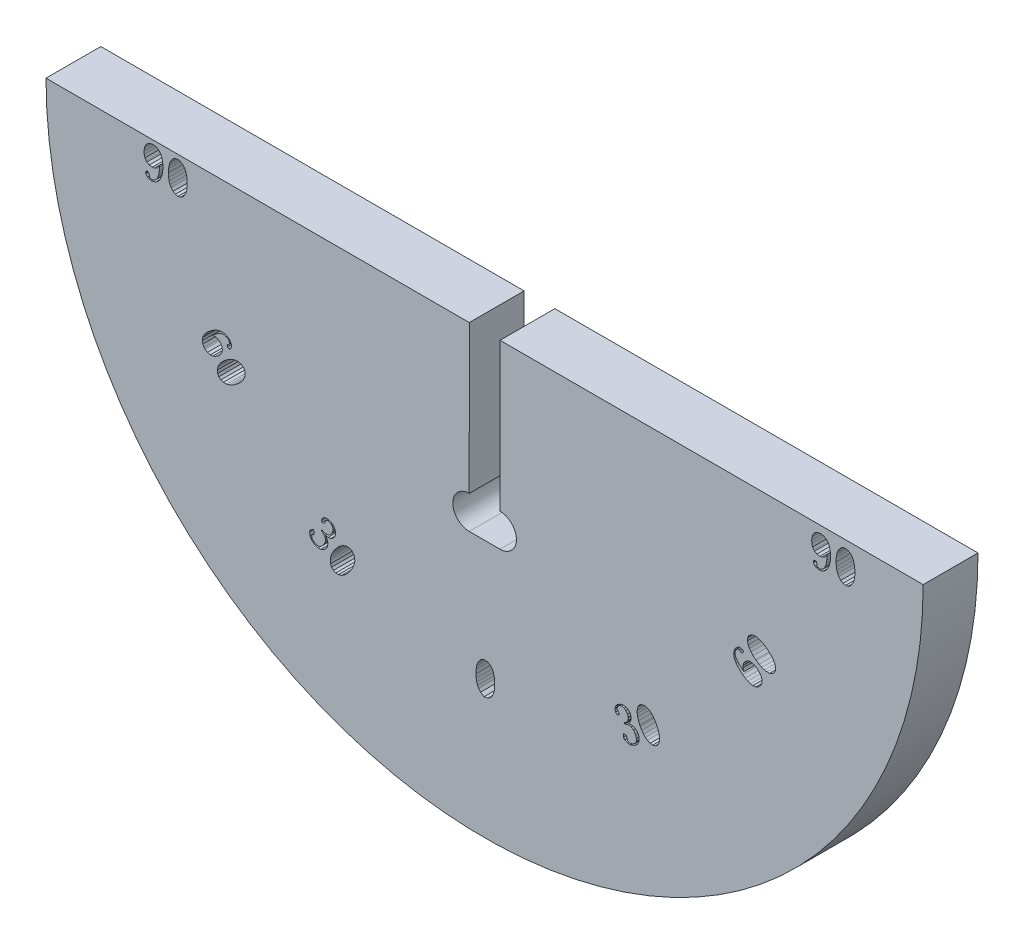
from build123d import *

# Parameters (mm, degrees)
EXTRUDE_3_DEPTH = 5


with BuildPart() as part:
    # 草图2 → 凸台-拉伸3 (new body)
    with BuildSketch(Plane.XY):
        with BuildLine():
            Line((2565.122979534, 4740.756474013), (2560.122979534, 4740.756474013))
            ThreePointArc((2560.122979534, 4740.756474013), (2560.129071728, 4740.058377756), (2560.147346453, 4739.360494145))
            ThreePointArc((2560.147346453, 4739.360494145), (2560.177798144, 4738.663035764), (2560.220417524, 4737.966215064))
            ThreePointArc((2560.220417524, 4737.966215064), (2560.275191611, 4737.270244303), (2560.342103719, 4736.575335483))
            ThreePointArc((2560.342103719, 4736.575335483), (2560.421133469, 4735.881700277), (2560.512256785, 4735.189549975))
            ThreePointArc((2560.512256785, 4735.189549975), (2560.61544591, 4734.499095412), (2560.730669414, 4733.810546907))
            ThreePointArc((2560.730669414, 4733.810546907), (2560.857892196, 4733.124114198), (2560.997075505, 4732.440006381))
            ThreePointArc((2560.997075505, 4732.440006381), (2561.148176943, 4731.75843184), (2561.311150483, 4731.079598189))
            ThreePointArc((2561.311150483, 4731.079598189), (2561.485946483, 4730.403712209), (2561.672511697, 4729.730979781))
            ThreePointArc((2561.672511697, 4729.730979781), (2561.870789296, 4729.061605824), (2562.080718882, 4728.395794238))
            ThreePointArc((2562.080718882, 4728.395794238), (2562.30223651, 4727.733747835), (2562.535274703, 4727.07566828))
            ThreePointArc((2562.535274703, 4727.07566828), (2562.779762474, 4726.421756031), (2563.035625352, 4725.772210277))
            ThreePointArc((2563.035625352, 4725.772210277), (2563.302785396, 4725.127228874), (2563.581161229, 4724.48700829))
            ThreePointArc((2563.581161229, 4724.48700829), (2563.870668053, 4723.851743544), (2564.171217682, 4723.221628142))
            ThreePointArc((2564.171217682, 4723.221628142), (2564.482718567, 4722.596854024), (2564.80507582, 4721.977611502))
            ThreePointArc((2564.80507582, 4721.977611502), (2565.138191249, 4721.364089203), (2565.481963383, 4720.756474013))
            ThreePointArc((2565.481963383, 4720.756474013), (2565.836287506, 4720.154951017), (2566.201055688, 4719.559703444))
            ThreePointArc((2566.201055688, 4719.559703444), (2566.576156816, 4718.970912613), (2566.961476632, 4718.388757874))
            ThreePointArc((2566.961476632, 4718.388757874), (2567.356897763, 4717.813416559), (2567.762299759, 4717.245063922))
            ThreePointArc((2567.762299759, 4717.245063922), (2568.177559132, 4716.683873087), (2568.60254939, 4716.130015))
            ThreePointArc((2568.60254939, 4716.130015), (2569.037141076, 4715.583658371), (2569.481201809, 4715.044969626))
            ThreePointArc((2569.481201809, 4715.044969626), (2569.934596325, 4714.514112854), (2570.397186515, 4713.991249759))
            ThreePointArc((2570.397186515, 4713.991249759), (2570.868831469, 4713.476539611), (2571.349387521, 4712.970139195))
            ThreePointArc((2571.349387521, 4712.970139195), (2571.838708287, 4712.472202766), (2572.336644716, 4711.982882))
            ThreePointArc((2572.336644716, 4711.982882), (2572.843045132, 4711.502325949), (2573.35775528, 4711.030680994))
            ThreePointArc((2573.35775528, 4711.030680994), (2573.880618375, 4710.568090804), (2574.411475147, 4710.114696289))
            ThreePointArc((2574.411475147, 4710.114696289), (2574.950163892, 4709.670635555), (2575.496520521, 4709.236043869))
            ThreePointArc((2575.496520521, 4709.236043869), (2576.050378608, 4708.811053611), (2576.611569443, 4708.395794238))
            ThreePointArc((2576.611569443, 4708.395794238), (2577.17992208, 4707.990392242), (2577.755263395, 4707.594971111))
            ThreePointArc((2577.755263395, 4707.594971111), (2578.337418134, 4707.209651295), (2578.926208965, 4706.834550167))
            ThreePointArc((2578.926208965, 4706.834550167), (2579.521456538, 4706.469781985), (2580.122979534, 4706.115457862))
            ThreePointArc((2580.122979534, 4706.115457862), (2580.730594724, 4705.771685728), (2581.344117023, 4705.438570299))
            ThreePointArc((2581.344117023, 4705.438570299), (2581.963359545, 4705.116213046), (2582.588133663, 4704.804712161))
            ThreePointArc((2582.588133663, 4704.804712161), (2583.218249065, 4704.504162532), (2583.853513811, 4704.214655708))
            ThreePointArc((2583.853513811, 4704.214655708), (2584.493734395, 4703.936279875), (2585.138715798, 4703.669119831))
            ThreePointArc((2585.138715798, 4703.669119831), (2585.788261552, 4703.413256953), (2586.442173801, 4703.168769182))
            ThreePointArc((2586.442173801, 4703.168769182), (2587.100253356, 4702.935730989), (2587.762299759, 4702.714213361))
            ThreePointArc((2587.762299759, 4702.714213361), (2588.428111345, 4702.504283775), (2589.097485302, 4702.306006176))
            ThreePointArc((2589.097485302, 4702.306006176), (2589.77021773, 4702.119440962), (2590.44610371, 4701.944644962))
            ThreePointArc((2590.44610371, 4701.944644962), (2591.12493736, 4701.781671422), (2591.806511902, 4701.630569984))
            ThreePointArc((2591.806511902, 4701.630569984), (2592.490619719, 4701.491386675), (2593.177052428, 4701.364163893))
            ThreePointArc((2593.177052428, 4701.364163893), (2593.865600933, 4701.248940389), (2594.556055496, 4701.145751264))
            ThreePointArc((2594.556055496, 4701.145751264), (2595.248205798, 4701.054627948), (2595.941841004, 4700.975598199))
            ThreePointArc((2595.941841004, 4700.975598199), (2596.636749824, 4700.90868609), (2597.332720584, 4700.853912003))
            ThreePointArc((2597.332720584, 4700.853912003), (2598.029541285, 4700.811292623), (2598.726999666, 4700.780840933))
            ThreePointArc((2598.726999666, 4700.780840933), (2599.424883277, 4700.762566207), (2600.122979534, 4700.756474013))
            ThreePointArc((2600.122979534, 4700.756474013), (2600.821075792, 4700.762566207), (2601.518959402, 4700.780840933))
            ThreePointArc((2601.518959402, 4700.780840933), (2602.216417784, 4700.811292623), (2602.913238484, 4700.853912003))
            ThreePointArc((2602.913238484, 4700.853912003), (2603.609209244, 4700.90868609), (2604.304118065, 4700.975598199))
            ThreePointArc((2604.304118065, 4700.975598199), (2604.99775327, 4701.054627948), (2605.689903573, 4701.145751264))
            ThreePointArc((2605.689903573, 4701.145751264), (2606.380358136, 4701.248940389), (2607.068906641, 4701.364163893))
            ThreePointArc((2607.068906641, 4701.364163893), (2607.755339349, 4701.491386675), (2608.439447167, 4701.630569984))
            ThreePointArc((2608.439447167, 4701.630569984), (2609.121021708, 4701.781671422), (2609.799855358, 4701.944644962))
            ThreePointArc((2609.799855358, 4701.944644962), (2610.475741338, 4702.119440962), (2611.148473767, 4702.306006176))
            ThreePointArc((2611.148473767, 4702.306006176), (2611.817847723, 4702.504283775), (2612.483659309, 4702.714213361))
            ThreePointArc((2612.483659309, 4702.714213361), (2615.107243271, 4703.669119831), (2617.657825406, 4704.804712161))
            ThreePointArc((2617.657825406, 4704.804712161), (2618.282599524, 4705.116213046), (2618.901842046, 4705.438570299))
            ThreePointArc((2618.901842046, 4705.438570299), (2619.515364344, 4705.771685728), (2620.122979534, 4706.115457862))
            ThreePointArc((2620.122979534, 4706.115457862), (2620.724502531, 4706.469781985), (2621.319750104, 4706.834550167))
            ThreePointArc((2621.319750104, 4706.834550167), (2621.908540935, 4707.209651295), (2622.490695673, 4707.594971111))
            ThreePointArc((2622.490695673, 4707.594971111), (2623.066036988, 4707.990392242), (2623.634389626, 4708.395794238))
            ThreePointArc((2623.634389626, 4708.395794238), (2624.19558046, 4708.811053611), (2624.749438547, 4709.236043869))
            ThreePointArc((2624.749438547, 4709.236043869), (2625.295795176, 4709.670635555), (2625.834483922, 4710.114696289))
            ThreePointArc((2625.834483922, 4710.114696289), (2626.365340694, 4710.568090804), (2626.888203789, 4711.030680994))
            ThreePointArc((2626.888203789, 4711.030680994), (2627.402913937, 4711.502325949), (2627.909314353, 4711.982882))
            ThreePointArc((2627.909314353, 4711.982882), (2628.407250782, 4712.472202766), (2628.896571548, 4712.970139195))
            ThreePointArc((2628.896571548, 4712.970139195), (2629.377127599, 4713.476539611), (2629.848772553, 4713.991249759))
            ThreePointArc((2629.848772553, 4713.991249759), (2630.311362743, 4714.514112854), (2630.764757259, 4715.044969626))
            ThreePointArc((2630.764757259, 4715.044969626), (2631.208817993, 4715.583658371), (2631.643409678, 4716.130015))
            ThreePointArc((2631.643409678, 4716.130015), (2632.068399936, 4716.683873087), (2632.483659309, 4717.245063922))
            ThreePointArc((2632.483659309, 4717.245063922), (2632.889061306, 4717.813416559), (2633.284482436, 4718.388757874))
            ThreePointArc((2633.284482436, 4718.388757874), (2633.669802252, 4718.970912613), (2634.04490338, 4719.559703444))
            ThreePointArc((2634.04490338, 4719.559703444), (2634.409671562, 4720.154951017), (2634.763995686, 4720.756474013))
            ThreePointArc((2634.763995686, 4720.756474013), (2635.10776782, 4721.364089203), (2635.440883249, 4721.977611502))
            ThreePointArc((2635.440883249, 4721.977611502), (2635.763240502, 4722.596854024), (2636.074741386, 4723.221628142))
            ThreePointArc((2636.074741386, 4723.221628142), (2636.375291016, 4723.851743544), (2636.66479784, 4724.48700829))
            ThreePointArc((2636.66479784, 4724.48700829), (2636.943173672, 4725.127228874), (2637.210333717, 4725.772210277))
            ThreePointArc((2637.210333717, 4725.772210277), (2637.466196594, 4726.421756031), (2637.710684366, 4727.07566828))
            ThreePointArc((2637.710684366, 4727.07566828), (2637.943722558, 4727.733747835), (2638.165240186, 4728.395794238))
            ThreePointArc((2638.165240186, 4728.395794238), (2638.375169773, 4729.061605824), (2638.573447372, 4729.730979781))
            ThreePointArc((2638.573447372, 4729.730979781), (2638.760012586, 4730.403712209), (2638.934808585, 4731.079598189))
            ThreePointArc((2638.934808585, 4731.079598189), (2639.097782126, 4731.75843184), (2639.248883564, 4732.440006381))
            ThreePointArc((2639.248883564, 4732.440006381), (2639.388066872, 4733.124114198), (2639.515289655, 4733.810546907))
            ThreePointArc((2639.515289655, 4733.810546907), (2639.630513158, 4734.499095412), (2639.733702284, 4735.189549975))
            ThreePointArc((2639.733702284, 4735.189549975), (2639.8248256, 4735.881700277), (2639.903855349, 4736.575335483))
            ThreePointArc((2639.903855349, 4736.575335483), (2639.970767458, 4737.270244303), (2640.025541545, 4737.966215064))
            ThreePointArc((2640.025541545, 4737.966215064), (2640.068160924, 4738.663035764), (2640.098612615, 4739.360494145))
            ThreePointArc((2640.098612615, 4739.360494145), (2640.11688734, 4740.058377756), (2640.122979534, 4740.756474013))
            Line((2640.122979534, 4740.756474013), (2635.122979534, 4740.756474013))
            Line((2635.122979534, 4740.756474013), (2630.122979534, 4740.756474013))
            Line((2630.122979534, 4740.756474013), (2601.530485782, 4740.756474013))
            Line((2601.530485782, 4740.756474013), (2601.522979534, 4727.257622147))
            ThreePointArc((2601.522979534, 4727.257622147), (2603.022979534, 4725.757622147), (2601.522979534, 4724.257622147))
            Line((2601.522979534, 4724.257622147), (2598.722979534, 4724.257622147))
            ThreePointArc((2598.722979534, 4724.257622147), (2597.222979534, 4725.757622147), (2598.722979534, 4727.257622147))
            Line((2598.722979534, 4727.257622147), (2598.726122754, 4740.756474013))
            Line((2598.726122754, 4740.756474013), (2570.122979534, 4740.756474013))
            Line((2570.122979534, 4740.756474013), (2565.122979534, 4740.756474013))
        make_face()
        Polygon((2587.266281908, 4717.403483066), (2587.533817378, 4717.490890938), (2587.778642766, 4717.48125095), (2587.996984016, 4717.387094383), (2588.001754706, 4717.380330427), (2588.171539156, 4717.211411133), (2588.265923459, 4716.984246924), (2588.287897511, 4716.716139769), (2588.255792785, 4716.49598486), (2588.179330266, 4716.259737088), (2588.062888565, 4716.015549122), (2587.905471048, 4715.757653638), (2587.870050082, 4715.707348917), (2587.684792583, 4715.460203921), (2587.494976868, 4715.255423453), (2587.30159957, 4715.098774835), (2587.106049401, 4714.981108766), (2587.073226254, 4714.963022638), (2586.798534749, 4714.8857607), (2586.552712727, 4714.889633364), (2586.337753456, 4714.986175277), (2586.171350983, 4715.157479916), (2586.073584703, 4715.38225878), (2586.049225305, 4715.653747913), (2586.075562708, 4715.874899455), (2586.145261272, 4716.106376537), (2586.259317628, 4716.353946481), (2586.414349799, 4716.615223942), (2586.461909965, 4716.684219345), (2586.648556176, 4716.92221504), (2586.83399328, 4717.11884284), (2587.033137901, 4717.274494825), (2587.237837371, 4717.393549606), align=None, mode=Mode.SUBTRACT)
        Polygon((2584.229776329, 4717.120433462), (2584.485404371, 4717.300730645), (2584.597496294, 4717.06579826), (2584.560261667, 4716.953441697), (2584.447055207, 4716.848274038), (2584.353748536, 4716.772335074), (2584.367390315, 4716.559123725), (2584.537958925, 4716.360371184), (2584.548496938, 4716.352610595), (2584.800837572, 4716.231790283), (2585.03612158, 4716.235678207), (2585.232063829, 4716.338427652), (2585.427646867, 4716.542211487), (2585.470828422, 4716.603054222), (2585.596419424, 4716.8486309), (2585.625746726, 4717.087084412), (2585.547063206, 4717.284807452), (2585.361577973, 4717.483167915), (2585.238503792, 4717.578680325), (2585.293824546, 4717.658213742), (2585.54616518, 4717.537393429), (2585.780844635, 4717.520597407), (2585.786611958, 4717.519600774), (2586.004234786, 4717.627512988), (2586.16838339, 4717.804061395), (2586.281443113, 4718.045864015), (2586.310345467, 4718.213116385), (2586.235256399, 4718.448825341), (2586.100860046, 4718.581931589), (2585.855070893, 4718.67192202), (2585.640045884, 4718.596228399), (2585.563011681, 4718.425414447), (2585.544680209, 4718.336519256), (2585.440230972, 4718.247656933), (2585.316731842, 4718.271968202), (2585.2495501, 4718.381580209), (2585.299740954, 4718.568911972), (2585.488347562, 4718.732324546), (2585.714302663, 4718.785340954), (2585.969061512, 4718.747256431), (2586.206485522, 4718.626044039), (2586.212252845, 4718.625047406), (2586.403113322, 4718.440606935), (2586.512414248, 4718.213834805), (2586.524520579, 4718.14640772), (2586.524814052, 4717.873137796), (2586.442796683, 4717.673487228), (2586.257359579, 4717.476859428), (2586.099011168, 4717.385432155), (2585.855362018, 4717.35032227), (2585.616516426, 4717.394566196), (2585.764587428, 4717.134366366), (2585.825756504, 4716.904032653), (2585.829105613, 4716.820300231), (2585.780875156, 4716.558385348), (2585.697681549, 4716.403484652), (2585.523387012, 4716.219780211), (2585.292236272, 4716.102326616), (2585.182836739, 4716.070745445), (2584.941785407, 4716.067854153), (2584.699770312, 4716.145313305), (2584.5190229, 4716.250792045), (2584.319013122, 4716.433843804), (2584.197180917, 4716.656841876), (2584.189632802, 4716.681904434), (2584.161891426, 4716.951008222), align=None, mode=Mode.SUBTRACT)
        Polygon((2600.431885424, 4711.949028102), (2600.074054063, 4711.878739799), (2599.757300786, 4712.081461896), (2599.583481432, 4712.288389699), (2599.48001753, 4712.48704039), (2599.405523521, 4712.71879953), (2599.355860848, 4712.983667118), (2599.335168068, 4713.28578171), (2599.335168068, 4713.372691388), (2599.347583736, 4713.670667424), (2599.393107853, 4713.939673568), (2599.463463306, 4714.183848376), (2599.566927207, 4714.394914735), (2599.583481432, 4714.423884628), (2599.75316223, 4714.643228099), (2599.955951477, 4714.775661893), (2600.191849173, 4714.821186009), (2600.200126285, 4714.821186009), (2600.431885424, 4714.779800449), (2600.642951784, 4714.647366655), (2600.816771138, 4714.440438852), (2600.911957928, 4714.237649605), (2600.986451937, 4714.001751909), (2601.027837497, 4713.732745765), (2601.048530278, 4713.430631173), (2601.048530278, 4713.372691388), (2601.03611461, 4713.062299683), (2600.994729049, 4712.789154983), (2600.928512152, 4712.544980175), (2600.833325362, 4712.338052372), (2600.816771138, 4712.304943924), (2600.634674671, 4712.085600452), align=None, mode=Mode.SUBTRACT)
        Polygon((2612.797744532, 4715.021584576), (2612.766617887, 4715.332846366), (2613.026294052, 4715.314787739), (2613.105771914, 4715.22707409), (2613.141598886, 4715.076766516), (2613.161777346, 4714.95816765), (2613.354088887, 4714.865100747), (2613.611053085, 4714.915752739), (2613.622995327, 4714.921106179), (2613.852368647, 4715.081297388), (2613.96479021, 4715.288022017), (2613.971790512, 4715.509159551), (2613.890665172, 4715.779713161), (2613.85895634, 4715.847248596), (2613.707001164, 4716.077445532), (2613.513865946, 4716.220340442), (2613.303023423, 4716.24916625), (2613.039058615, 4716.185336593), (2612.895339904, 4716.125213329), (2612.853336, 4716.212515231), (2613.08270932, 4716.37270644), (2613.212838373, 4716.568724251), (2613.216544582, 4716.573254076), (2613.229721878, 4716.815805308), (2613.156832633, 4717.045590559), (2613.001994864, 4717.263021638), (2612.870629956, 4717.370501692), (2612.62849047, 4717.421152945), (2612.446474186, 4717.36967746), (2612.247162405, 4717.200014857), (2612.207217971, 4716.97558286), (2612.317992858, 4716.824451793), (2612.386352032, 4716.764740645), (2612.412295739, 4716.630081521), (2612.330347339, 4716.534543401), (2612.201865209, 4716.530013392), (2612.06349963, 4716.665907754), (2612.014083061, 4716.910517902), (2612.079147403, 4717.133302729), (2612.237690764, 4717.336321212), (2612.460063475, 4717.483334755), (2612.463769684, 4717.48786458), (2612.718263035, 4717.563224671), (2612.969462108, 4717.546752975), (2613.034115011, 4717.524103976), (2613.272136604, 4717.389856968), (2613.405560613, 4717.220194857), (2613.485450529, 4716.961995297), (2613.487098007, 4716.779155336), (2613.397737373, 4716.549781646), (2613.241664797, 4716.363647038), (2613.541044646, 4716.364471084), (2613.771653698, 4716.304348375), (2613.846189866, 4716.266050926), (2614.050443772, 4716.095153515), (2614.144334785, 4715.946493233), (2614.218459453, 4715.704353932), (2614.206929388, 4715.445330633), (2614.180574242, 4715.334555931), (2614.064446471, 4715.123301477), (2613.877900547, 4714.95075628), (2613.697119748, 4714.845334772), (2613.439331996, 4714.76132684), (2613.18525033, 4714.765032679), (2613.159718615, 4714.770797865), (2612.911813819, 4714.87910135), align=None, mode=Mode.SUBTRACT)
        Polygon((2614.045911422, 4717.804130644), (2614.101504245, 4718.080037879), (2614.230397874, 4718.28840974), (2614.419826453, 4718.43212882), (2614.428062486, 4718.432952436), (2614.658671353, 4718.497605648), (2614.902869817, 4718.467956286), (2615.147068403, 4718.355122976), (2615.32290794, 4718.218816868), (2615.490923312, 4718.035977153), (2615.646172889, 4717.814428058), (2615.793186494, 4717.550463373), (2615.819541886, 4717.49487018), (2615.943494623, 4717.211962583), (2616.028326171, 4716.945938797), (2616.069506707, 4716.700505034), (2616.07568407, 4716.47236689), (2616.075272324, 4716.434892933), (2616.007325451, 4716.157750275), (2615.882961646, 4715.945672205), (2615.69312126, 4715.806071141), (2615.462100585, 4715.745535946), (2615.218313929, 4715.771067291), (2614.969997326, 4715.883488793), (2614.790451581, 4716.015265077), (2614.623259824, 4716.189868759), (2614.463892231, 4716.411006046), (2614.312760609, 4716.674558923), (2614.276110145, 4716.749918583), (2614.160805249, 4717.02953178), (2614.080915333, 4717.28773134), (2614.043441006, 4717.537694928), (2614.040558043, 4717.774480912), align=None, mode=Mode.SUBTRACT)
        Polygon((2577.959487938, 4727.055635508), (2578.150101773, 4726.896800274), (2578.262947069, 4726.68843428), (2578.295081207, 4726.446135647), (2578.242363893, 4726.178446208), (2578.147719395, 4725.975318963), (2578.013845045, 4725.773775039), (2577.833938648, 4725.567540014), (2577.609466197, 4725.360484097), (2577.564782817, 4725.32430356), (2577.317616893, 4725.139120223), (2577.077370492, 4724.995570951), (2576.849379816, 4724.896059959), (2576.628308663, 4724.838183032), (2576.590017031, 4724.830559944), (2576.305673887, 4724.827628355), (2576.072933645, 4724.902511368), (2575.891796308, 4725.055208983), (2575.775748937, 4725.2629104), (2575.745080792, 4725.509079241), (2575.796332112, 4725.772898472), (2575.883236195, 4725.978957705), (2576.014706331, 4726.185837831), (2576.189276527, 4726.389668641), (2576.409878769, 4726.598190553), (2576.478838944, 4726.651728361), (2576.719202672, 4726.830637276), (2576.956517085, 4726.966446132), (2577.188377969, 4727.064491131), (2577.417189538, 4727.11943607), (2577.448678974, 4727.120784736), (2577.726747697, 4727.130518521), align=None, mode=Mode.SUBTRACT)
        Polygon((2576.077334417, 4726.958706913), (2575.910504637, 4726.751944114), (2575.830344285, 4726.680521261), (2575.579835928, 4726.509880535), (2575.34557083, 4726.417171738), (2575.12221279, 4726.399990657), (2575.11300638, 4726.399052437), (2574.849714923, 4726.463380374), (2574.638964589, 4726.596316504), (2574.559801321, 4726.679408843), (2574.424930685, 4726.907516847), (2574.372917734, 4727.144068832), (2574.408160449, 4727.400675421), (2574.410154216, 4727.417622246), (2574.495592305, 4727.619811271), (2574.627062441, 4727.826691397), (2574.814709254, 4728.029994434), (2575.02411132, 4728.2206313), (2575.271277243, 4728.405814637), (2575.512989638, 4728.553234117), (2575.747782509, 4728.659019531), (2575.971785651, 4728.724636873), (2576.118149981, 4728.748854804), (2576.387422741, 4728.735367342), (2576.622567196, 4728.655148127), (2576.823583347, 4728.50819716), (2576.905150829, 4728.419768619), (2577.027883068, 4728.182981979), (2577.044360584, 4728.039549637), (2576.95587318, 4727.794260552), (2576.945200777, 4727.789452124), (2576.808863748, 4727.72160636), (2576.684606652, 4727.790801189), (2576.642914122, 4727.92608267), (2576.711053404, 4728.024186531), (2576.784822007, 4728.067051936), (2576.836307583, 4728.109506894), (2576.883629832, 4728.211070517), (2576.806694986, 4728.381828969), (2576.610076817, 4728.54039056), (2576.363732185, 4728.60272473), (2576.283806488, 4728.602021164), (2576.117563345, 4728.572056585), (2575.921589878, 4728.486970876), (2575.681343477, 4728.343421605), (2575.411366754, 4728.144751204), (2575.278782606, 4728.040079802), (2575.545768479, 4728.067288185), (2575.717113169, 4728.028937691), (2575.942406114, 4727.899343995), (2576.023973596, 4727.810915454), (2576.168988862, 4727.574539261), (2576.21032941, 4727.333178848), (2576.187577074, 4727.191329826), align=None, mode=Mode.SUBTRACT)
        Polygon((2570.782542978, 4739.089781979), (2570.764747187, 4738.662682994), (2570.666663408, 4738.270347879), (2570.571476619, 4738.046865852), (2570.51767539, 4737.939263394), (2570.347994591, 4737.719919923), (2570.1493439, 4737.570931904), (2569.921723317, 4737.488160783), (2569.747903962, 4737.471606559), (2569.483036374, 4737.521269232), (2569.383711029, 4737.57507046), (2569.226445899, 4737.769582595), (2569.218168786, 4737.839938048), (2569.251277235, 4737.972371842), (2569.383711029, 4738.038588739), (2569.516144823, 4737.955817618), (2569.549253271, 4737.773721151), (2569.565807496, 4737.674395806), (2569.598915944, 4737.608178909), (2569.665132841, 4737.591624685), (2569.747903962, 4737.57507046), (2569.983801658, 4737.624733133), (2570.178313793, 4737.781998264), (2570.26522347, 4737.906154945), (2570.339717479, 4738.084112856), (2570.40179582, 4738.307594883), (2570.447319937, 4738.580739584), (2570.476289829, 4738.903546956), (2570.480428385, 4739.040119306), (2570.343856035, 4738.816637279), (2570.232115022, 4738.704896265), (2570.008632994, 4738.597293808), (2569.818259415, 4738.572462471), (2569.545114715, 4738.613848032), (2569.3299098, 4738.729727602), (2569.267831459, 4738.791805943), (2569.147813333, 4738.973902409), (2569.081596436, 4739.226354329), (2569.065042212, 4739.458113469), (2569.098150661, 4739.731258169), (2569.185060338, 4739.97129442), (2569.284385683, 4740.124420995), (2569.470620706, 4740.285824681), (2569.706518402, 4740.372734359), (2569.901030537, 4740.389288583), (2570.161759569, 4740.352041578), (2570.376964484, 4740.236162008), (2570.550783838, 4740.058204098), (2570.65424774, 4739.863691963), (2570.728741749, 4739.627794267), (2570.77012731, 4739.350511011), align=None, mode=Mode.SUBTRACT)
        Polygon((2573.004563587, 4738.904627165), (2572.98609989, 4738.449189314), (2572.884545461, 4738.081054509), (2572.789358671, 4737.874126705), (2572.768665891, 4737.841018257), (2572.59070798, 4737.61753623), (2572.387918733, 4737.485102436), (2572.156159594, 4737.439578319), (2571.920261898, 4737.485102436), (2571.713334095, 4737.613397674), (2571.539514741, 4737.824464033), (2571.436050839, 4738.018976168), (2571.357418274, 4738.250735307), (2571.311894157, 4738.515602895), (2571.291201377, 4738.817717488), (2571.287062821, 4738.904627165), (2571.303617045, 4739.206741758), (2571.345002606, 4739.475747902), (2571.419496615, 4739.715784153), (2571.522960516, 4739.926850512), (2571.539514741, 4739.955820405), (2571.709195539, 4740.175163876), (2571.911984786, 4740.311736226), (2572.147882482, 4740.357260343), (2572.156159594, 4740.357260343), (2572.387918733, 4740.311736226), (2572.594846536, 4740.179302432), (2572.768665891, 4739.972374629), (2572.867991237, 4739.773723938), (2572.93834669, 4739.537826242), (2572.983870806, 4739.268820098), (2573.004563587, 4738.966705506), align=None, mode=Mode.SUBTRACT)
        Polygon((2624.642789874, 4726.740028301), (2624.882832774, 4726.626175604), (2624.971020726, 4726.564940066), (2625.195511304, 4726.361281835), (2625.340432308, 4726.155192147), (2625.409369158, 4725.942044981), (2625.412434277, 4725.933313242), (2625.411460531, 4725.662279062), (2625.331494191, 4725.426285201), (2625.269218053, 4725.32988581), (2625.078974263, 4725.145411828), (2624.861144396, 4725.039523501), (2624.603411294, 4725.01378173), (2624.586468116, 4725.01175721), (2624.369905572, 4725.047544553), (2624.138017432, 4725.126990593), (2623.896470313, 4725.261892189), (2623.662150714, 4725.420907803), (2623.424302376, 4725.617915494), (2623.224446116, 4725.818451924), (2623.066687653, 4726.021996793), (2622.950506686, 4726.224444381), (2622.892733034, 4726.361087093), (2622.842877244, 4726.626047714), (2622.865883809, 4726.873431495), (2622.961752727, 4727.103238436), (2623.028654885, 4727.203223247), (2623.230175234, 4727.377924889), (2623.365777346, 4727.427487102), (2623.624957986, 4727.398813918), (2623.632128825, 4727.389561878), (2623.729975755, 4727.272870784), (2623.691756954, 4727.135877816), (2623.569976221, 4727.063705804), (2623.458658171, 4727.107014243), (2623.399730557, 4727.1687134), (2623.346412882, 4727.208843359), (2623.23659905, 4727.2311029), (2623.088566418, 4727.116369472), (2622.980380341, 4726.888123431), (2622.977382075, 4726.63403243), (2622.996756711, 4726.556487376), (2623.064766322, 4726.401860885), (2623.193321129, 4726.231218455), (2623.389071669, 4726.031202325), (2623.645367405, 4725.815170254), (2623.778141293, 4725.710739639), (2623.689252825, 4725.963960082), (2623.68647111, 4726.139522109), (2623.759786911, 4726.388873729), (2623.826689068, 4726.48885854), (2624.022599479, 4726.685129381), (2624.247600184, 4726.781765668), (2624.390836754, 4726.792815504), align=None, mode=Mode.SUBTRACT)
        Polygon((2624.108408299, 4728.547328321), (2624.218264542, 4728.769800502), (2624.394464327, 4728.928243186), (2624.622530152, 4729.016147734), (2624.895125232, 4729.027491146), (2625.114752895, 4728.982972064), (2625.342015016, 4728.899940604), (2625.584602735, 4728.773250448), (2625.838410332, 4728.603421894), (2625.884036868, 4728.568438255), (2626.121885206, 4728.371430564), (2626.317635746, 4728.171414434), (2626.46770307, 4727.973015885), (2626.575672597, 4727.771608897), (2626.592038795, 4727.736161639), (2626.661382583, 4727.460388078), (2626.643002038, 4727.216589716), (2626.536897161, 4727.004766555), (2626.36209233, 4726.843365991), (2626.129920785, 4726.755981743), (2625.861431424, 4726.744118031), (2625.640763162, 4726.780425673), (2625.408875021, 4726.859871713), (2625.169872721, 4726.98193585), (2624.915544824, 4727.147658684), (2624.847365171, 4727.202187002), (2624.617207972, 4727.394048374), (2624.429668871, 4727.593023904), (2624.280121847, 4727.795528172), (2624.17319292, 4728.005146599), (2624.164517862, 4728.035447537), (2624.090027754, 4728.30352996), align=None, mode=Mode.SUBTRACT)
        Polygon((2631.671990778, 4738.803566403), (2631.654194987, 4738.376467417), (2631.556111208, 4737.984132303), (2631.460924419, 4737.760650275), (2631.40712319, 4737.653047818), (2631.237442391, 4737.433704346), (2631.0387917, 4737.284716328), (2630.811171117, 4737.201945207), (2630.637351762, 4737.185390983), (2630.372484174, 4737.235053655), (2630.273158829, 4737.288854884), (2630.115893698, 4737.483367019), (2630.107616586, 4737.553722472), (2630.140725035, 4737.686156266), (2630.273158829, 4737.752373163), (2630.405592623, 4737.669602042), (2630.438701071, 4737.487505575), (2630.455255295, 4737.38818023), (2630.488363744, 4737.321963333), (2630.554580641, 4737.305409108), (2630.637351762, 4737.288854884), (2630.873249458, 4737.338517557), (2631.067761593, 4737.495782687), (2631.15467127, 4737.619939369), (2631.229165279, 4737.79789728), (2631.29124362, 4738.021379307), (2631.336767737, 4738.294524007), (2631.365737629, 4738.61733138), (2631.369876185, 4738.75390373), (2631.233303835, 4738.530421703), (2631.121562822, 4738.418680689), (2630.898080794, 4738.311078231), (2630.707707215, 4738.286246895), (2630.434562515, 4738.327632456), (2630.2193576, 4738.443512025), (2630.157279259, 4738.505590366), (2630.037261133, 4738.687686833), (2629.971044236, 4738.940138753), (2629.954490012, 4739.171897892), (2629.98759846, 4739.445042593), (2630.074508138, 4739.685078844), (2630.173833483, 4739.838205418), (2630.360068506, 4739.999609105), (2630.595966202, 4740.086518782), (2630.790478337, 4740.103073006), (2631.051207368, 4740.065826002), (2631.266412284, 4739.949946432), (2631.440231638, 4739.771988521), (2631.54369554, 4739.577476387), (2631.618189549, 4739.341578691), (2631.65957511, 4739.064295435), align=None, mode=Mode.SUBTRACT)
        Polygon((2633.894011386, 4738.618411589), (2633.87554769, 4738.162973738), (2633.773993261, 4737.794838932), (2633.678806471, 4737.587911129), (2633.658113691, 4737.554802681), (2633.48015578, 4737.331320653), (2633.277366533, 4737.198886859), (2633.045607394, 4737.153362743), (2632.809709698, 4737.198886859), (2632.602781895, 4737.327182097), (2632.42896254, 4737.538248456), (2632.325498639, 4737.732760591), (2632.246866074, 4737.964519731), (2632.201341957, 4738.229387319), (2632.180649177, 4738.531501911), (2632.176510621, 4738.618411589), (2632.193064845, 4738.920526181), (2632.234450405, 4739.189532325), (2632.308944415, 4739.429568577), (2632.412408316, 4739.640634936), (2632.42896254, 4739.669604828), (2632.598643339, 4739.8889483), (2632.801432586, 4740.02552065), (2633.037330282, 4740.071044766), (2633.045607394, 4740.071044766), (2633.277366533, 4740.02552065), (2633.484294336, 4739.893086856), (2633.658113691, 4739.686159053), (2633.757439036, 4739.487508362), (2633.827794489, 4739.251610666), (2633.873318606, 4738.982604522), (2633.894011386, 4738.68048993), align=None, mode=Mode.SUBTRACT)
    extrude(amount=EXTRUDE_3_DEPTH)


solid = part.part
